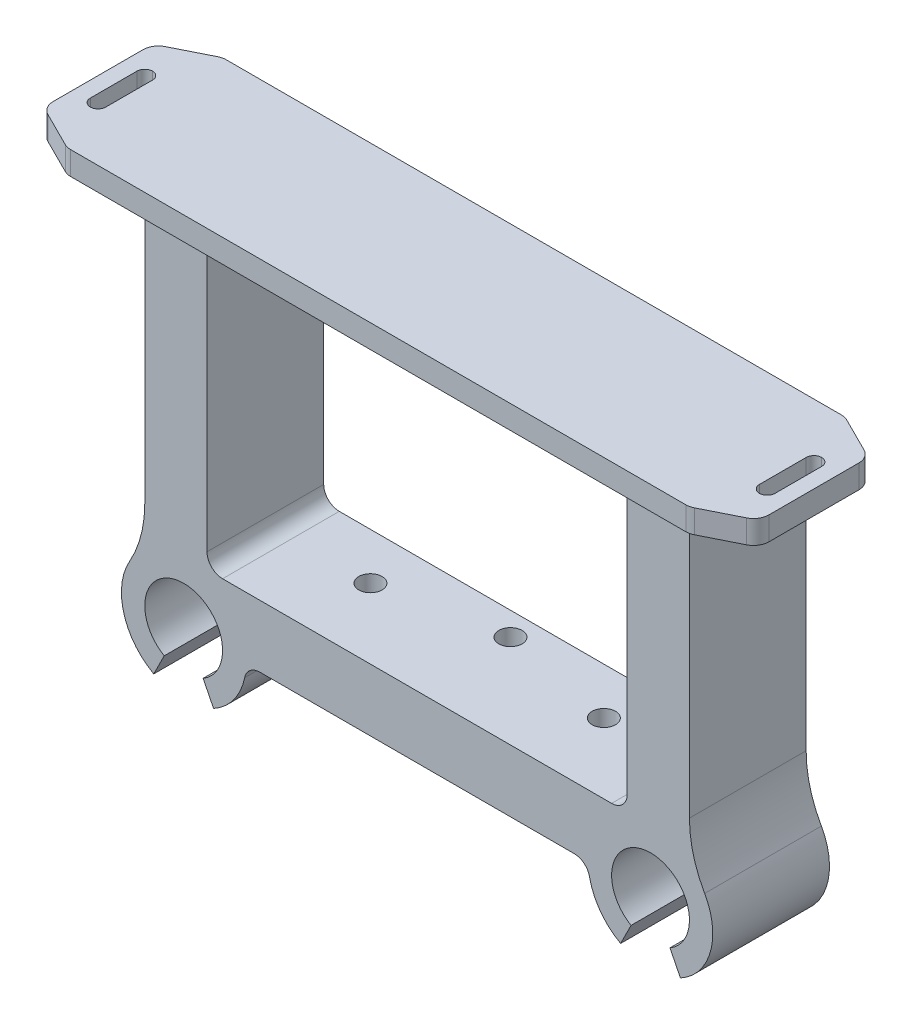
from build123d import *

# Parameters (mm, degrees)
BOSS_EXTRUDE1_DEPTH = 15
SKETCH4_R           = 8.000000000000002
SKETCH4_R_2         = 7.999999999999998
BOSS_EXTRUDE2_DEPTH = 15
SKETCH5_R           = 5.000000000000004
SKETCH5_R_2         = 5.0000000000000036
CUT_EXTRUDE2_DEPTH  = 15
FILLET2_R           = 15
FILLET3_R           = 2
FILLET4_R           = 2
BOSS_EXTRUDE3_DEPTH = 3
CUT_EXTRUDE3_REACH  = 76.188
SKETCH10_R          = 1.5000000000000007
SKETCH10_R_2        = 1.500000000000004
BOSS_EXTRUDE4_DEPTH = 10.000000000000002
BOSS_EXTRUDE5_DEPTH = 3
CUT_EXTRUDE5_REACH  = 90.637
FILLET5_R           = 1
FILLET6_R           = 2
CUT_EXTRUDE6_REACH  = 80.013
FILLET7_R           = 6
FILLET8_R           = 6
FILLET9_R           = 2
CUT_EXTRUDE7_DEPTH  = 15
FILLET10_R          = 2


# Some blends are built 0.0001 mm under size
with BuildPart() as part:
    # Sketch1 → Boss-Extrude1 (new body)
    with BuildSketch(Plane.XY):
        Polygon((-17.948335406616224, 38.357764788911155), (-17.948335406616224, -1.642235211088847), (-9.948335406616222, -1.6422352110888458), (-9.948335406616222, 38.35776478891115), align=None)
        Polygon((52.051664593383784, -1.6422352110888379), (52.051664593383784, -9.642235211088838), (-17.948335406616224, -9.642235211088838), (-17.948335406616224, -1.642235211088847), align=None)
        Polygon((44.051664593383784, 38.35776478891116), (44.051664593383784, -1.6422352110888392), (52.05166459338378, -1.6422352110888379), (52.051664593383784, 38.35776478891116), align=None)
    extrude(amount=BOSS_EXTRUDE1_DEPTH)

    # Sketch4 → Boss-Extrude2 (add)
    with BuildSketch(Plane.XY.offset(15)):
        with Locations((-12.948335406616222, -9.642235211088838)):
            Circle(SKETCH4_R)
        with Locations((47.05166459338378, -9.64223521108884)):
            Circle(SKETCH4_R_2)
    extrude(amount=-BOSS_EXTRUDE2_DEPTH)

    # Sketch5 → Cut-Extrude2 (cut)
    with BuildSketch(Plane.XY.offset(15)):
        with Locations((-12.948335406616222, -9.642235211088838)):
            Circle(SKETCH5_R)
        with Locations((47.05166459338378, -9.642235211088837)):
            Circle(SKETCH5_R_2)
    extrude(amount=-CUT_EXTRUDE2_DEPTH, mode=Mode.SUBTRACT)

    # Fillet2
    fillet2_edges = [part.edges().sort_by_distance(p)[0] for p in [
        (-17.948335406616224, -3.397237212690439, 7.5),
        (52.051664593383784, -3.3972372126904498, 7.5),
    ]]
    fillet(fillet2_edges, radius=FILLET2_R)

    # Fillet3
    fillet3_edges = [part.edges().sort_by_distance(p)[0] for p in [
        (-4.94833540661622, -9.642235211088838, 7.5),
        (39.05166459338378, -9.642235211088838, 7.5),
    ]]
    fillet(fillet3_edges, radius=FILLET3_R)

    # Fillet4
    fillet4_edges = [part.edges().sort_by_distance(p)[0] for p in [
        (-9.948335406616222, -1.6422352110888463, 7.5),
        (44.051664593383784, -1.6422352110888392, 7.5),
    ]]
    fillet(fillet4_edges, radius=FILLET4_R)

    # Sketch6 → Boss-Extrude3 (add)
    with BuildSketch(Plane(origin=(3.327e-14, 38.35776478891114, 0), x_dir=(1, -4.3e-16, 0), z_dir=(4.3e-16, 1, 0))):
        Polygon((-22.948335406616234, 0), (57.05166459338378, 0), (57.05166459338378, -20), (-22.948335406616227, -20), align=None)
    extrude(amount=BOSS_EXTRUDE3_DEPTH)

    # Sketch10 → Cut-Extrude3 (cut, up to next)
    with BuildSketch(Plane(origin=(2.1e-16, -1.6422352110888447, 0), x_dir=(1, 1.3e-16, 0), z_dir=(-1.3e-16, 1, 0)), mode=Mode.PRIVATE) as cut_extrude3_sk1:
        with Locations(Location((2.0516645933837814, -6, 0), (0, 0, 180))):
            Circle(SKETCH10_R)
    cut_extrude3_tool1 = extrude(cut_extrude3_sk1.sketch, amount=-CUT_EXTRUDE3_REACH, mode=Mode.PRIVATE) & part.part
    # Sketch10 → Cut-Extrude3 (cut, up to next)
    with BuildSketch(Plane(origin=(2.1e-16, -1.6422352110888447, 0), x_dir=(1, 1.3e-16, 0), z_dir=(-1.3e-16, 1, 0)), mode=Mode.PRIVATE) as cut_extrude3_sk2:
        with Locations(Location((17.05166459338378, -3, 0), (0, 0, 180))):
            Circle(SKETCH10_R)
    cut_extrude3_tool2 = extrude(cut_extrude3_sk2.sketch, amount=-CUT_EXTRUDE3_REACH, mode=Mode.PRIVATE) & part.part
    # Sketch10 → Cut-Extrude3 (cut, up to next)
    with BuildSketch(Plane(origin=(2.1e-16, -1.6422352110888447, 0), x_dir=(1, 1.3e-16, 0), z_dir=(-1.3e-16, 1, 0)), mode=Mode.PRIVATE) as cut_extrude3_sk3:
        with Locations(Location((32.051664593383784, -6, 0), (0, 0, 180))):
            Circle(SKETCH10_R_2)
    cut_extrude3_tool3 = extrude(cut_extrude3_sk3.sketch, amount=-CUT_EXTRUDE3_REACH, mode=Mode.PRIVATE) & part.part
    add(cut_extrude3_tool1.solids().sort_by_distance((2.051665, -1.642235, 6))[0], mode=Mode.SUBTRACT)
    add(cut_extrude3_tool2.solids().sort_by_distance((17.051665, -1.642235, 3))[0], mode=Mode.SUBTRACT)
    add(cut_extrude3_tool3.solids().sort_by_distance((32.051665, -1.642235, 6))[0], mode=Mode.SUBTRACT)

    # Sketch11 → Boss-Extrude4 (add)
    with BuildSketch(Plane.XZ.offset(-38.35776478891114)):
        Polygon((24.55166459338377, 7.3e-16), (9.551664593383764, -2.02e-15), (9.551664593383764, 8.311370234309834), (24.551664593383766, 8.311370234309837), align=None)
    extrude(amount=BOSS_EXTRUDE4_DEPTH)

    # Sketch12 → Boss-Extrude5 (add)
    with BuildSketch(Plane(origin=(1.794e-14, 41.35776478891114, 0), x_dir=(1, -4.3e-16, 0), z_dir=(4.3e-16, 1, 0))):
        Polygon((-22.948335406616234, 0), (-28.94833540661623, -3), (-28.94833540661623, -17), (-22.948335406616227, -20), align=None)
        Polygon((57.05166459338377, -20.000000000000057), (63.05166459338377, -16.999999999999943), (63.05166459338377, -2.9999999999999574), (57.05166459338377, 0), align=None)
    extrude(amount=-BOSS_EXTRUDE5_DEPTH)

    # Sketch13 → Cut-Extrude5 (cut, up to next)
    with BuildSketch(Plane(origin=(1.794e-14, 41.35776478891114, 0), x_dir=(1, -4.3e-16, 0), z_dir=(4.3e-16, 1, 0)), mode=Mode.PRIVATE) as cut_extrude5_sk1:
        Polygon((59.05166459338377, -6), (61.05166459338377, -6), (61.05166459338378, -14), (59.05166459338377, -14), align=None)
    cut_extrude5_tool1 = extrude(cut_extrude5_sk1.sketch, amount=-CUT_EXTRUDE5_REACH, mode=Mode.PRIVATE) & part.part
    # Sketch13 → Cut-Extrude5 (cut, up to next)
    with BuildSketch(Plane(origin=(1.794e-14, 41.35776478891114, 0), x_dir=(1, -4.3e-16, 0), z_dir=(4.3e-16, 1, 0)), mode=Mode.PRIVATE) as cut_extrude5_sk2:
        Polygon((-26.948335406616234, -5.999999999999999), (-24.94833540661623, -6), (-24.94833540661623, -14.000000000000002), (-26.948335406616234, -14.000000000000002), align=None)
    cut_extrude5_tool2 = extrude(cut_extrude5_sk2.sketch, amount=-CUT_EXTRUDE5_REACH, mode=Mode.PRIVATE) & part.part
    add(cut_extrude5_tool1.solids().sort_by_distance((60.051665, 41.357765, 10))[0], mode=Mode.SUBTRACT)
    add(cut_extrude5_tool2.solids().sort_by_distance((-25.948335, 41.357765, 10))[0], mode=Mode.SUBTRACT)

    # Fillet5
    fillet5_edges = [part.edges().sort_by_distance(p)[0] for p in [
        (59.05166459338379, 39.85776478891111, 6),
        (61.05166459338379, 39.85776478891111, 6),
        (61.0516645933838, 39.85776478891111, 14),
        (59.05166459338379, 39.85776478891111, 14),
        (-26.948335406616216, 39.857764788911155, 14.000000000000002),
        (-24.948335406616213, 39.857764788911155, 14.000000000000002),
        (-24.948335406616213, 39.857764788911155, 6),
        (-26.948335406616216, 39.857764788911155, 5.999999999999999),
    ]]
    fillet(fillet5_edges, radius=FILLET5_R - 0.0001)  # a hair under: the kernel refuses the full size

    # Fillet6
    fillet6_edges = [part.edges().sort_by_distance(p)[0] for p in [
        (-22.948335406616202, 39.85776478891115, 0),
        (-22.948335406616195, 39.85776478891115, 20),
        (57.05166459338381, 39.85776478891112, 20),
        (57.05166459338381, 39.85776478891112, 0),
        (-28.948335406616213, 39.857764788911155, 17),
        (-28.948335406616213, 39.857764788911155, 3),
        (63.05166459338379, 39.85776478891111, 2.9999999999999574),
        (63.05166459338379, 39.85776478891111, 16.999999999999943),
    ]]
    fillet(fillet6_edges, radius=FILLET6_R)

    # Sketch14 → Cut-Extrude6 (cut, up to next)
    with BuildSketch(Plane(origin=(0, 0, 0), x_dir=(-1, 0, 0), z_dir=(0, 0, -1)), mode=Mode.PRIVATE) as cut_extrude6_sk1:
        Polygon((-42.051664593383784, -18.97236223001103), (-52.05166459338378, -18.97236223001103), (-49.55166459338378, -13.972362230011036), (-44.55166459338378, -13.972362230011036), align=None)
    cut_extrude6_tool1 = extrude(cut_extrude6_sk1.sketch, amount=-CUT_EXTRUDE6_REACH, mode=Mode.PRIVATE) & part.part
    # Sketch14 → Cut-Extrude6 (cut, up to next)
    with BuildSketch(Plane(origin=(0, 0, 0), x_dir=(-1, 0, 0), z_dir=(0, 0, -1)), mode=Mode.PRIVATE) as cut_extrude6_sk2:
        Polygon((17.948335406616224, -18.972362230011036), (7.948335406616221, -18.972362230011036), (10.448335406616224, -13.972362230011036), (15.448335406616224, -13.972362230011036), align=None)
    cut_extrude6_tool2 = extrude(cut_extrude6_sk2.sketch, amount=-CUT_EXTRUDE6_REACH, mode=Mode.PRIVATE) & part.part
    add(cut_extrude6_tool1.solids().sort_by_distance((47.051665, -16.75014, 0))[0], mode=Mode.SUBTRACT)
    add(cut_extrude6_tool2.solids().sort_by_distance((-12.948335, -16.75014, 0))[0], mode=Mode.SUBTRACT)

    # Fillet7
    fillet7_edges = [part.edges().sort_by_distance(p)[0] for p in [
        (24.55166459338378, 28.35776478891113, 4.155685117154919),
        (9.551664593383776, 28.357764788911137, 4.155685117154916),
    ]]
    fillet(fillet7_edges, radius=FILLET7_R)

    # Fillet8
    # the kernel refuses this fillet: 6 mm, written as the material it adds along each edge
    with BuildSketch(Plane(origin=(24.551664593383784, 38.35776478891113, 8.311370234309837), x_dir=(1, -1.22e-15, 4.3e-16), z_dir=(4.3e-16, 0, -1))) as fillet8_piece_1:
        with BuildLine():
            CenterArc((5.832159566204599, 6), FILLET8_R, 189.5940682268561, 80.40593177314383)
            Line((-0.08392021689509223, 5.000000000000448), (-0.675528195205062, 4.90000000000049))
            ThreePointArc((-0.675528195205062, 4.90000000000049), (-0.5999999999999965, 4.000000000000001), (-0.6000000000000014, 7.3e-16))
            Line((-0.6000000000000014, 7.3e-16), (-7.3e-16, -0.6000000000000014))
            Line((-7.3e-16, -0.6000000000000014), (5.832159566204594, -0.6000000000000014))
            Line((5.832159566204594, -0.6000000000000014), (5.832159566204595, 0))
        make_face()
    extrude(amount=8.311370234309837)
    with BuildSketch(Plane(origin=(9.55166459338378, 38.35776478891113, -2.02e-15), x_dir=(0.01678167981240219, -0.9998591776958763, 0), z_dir=(0, 0, 1))) as fillet8_piece_2:
        with BuildLine():
            CenterArc((5.901281631719588, -5.932028346925651), FILLET8_R, 98.63250366346277, 80.40593177319276)
            Line((-0.09787343445575636, -5.831338268056363), (-0.6977889410732921, -5.8212692601694345))
            Line((-0.6977889410732921, -5.8212692601694345), (-0.5999155066175272, 0.01006900788744134))
            Line((-0.5999155066175272, 0.01006900788744134), (0.01006900788744131, 0.5999155066175255))
            ThreePointArc((0.01006900788744131, 0.5999155066175255), (4.009505718670954, 0.5327887873679148), (4.9106464685856706, 0.5932028346925657))
            Line((4.9106464685856706, 0.5932028346925657), (5.000704210688756, 1e-17))
        make_face()
    extrude(amount=8.311370234309836)

    # Fillet9
    fillet9_edges = [part.edges().sort_by_distance(p)[0] for p in [
        (17.05166459338424, 38.35776478891257, 8.31137023431),
    ]]
    fillet(fillet9_edges, radius=FILLET9_R)

    # Sketch15 → Cut-Extrude7 (cut)
    with BuildSketch(Plane(origin=(0, 0, 0), x_dir=(-1, 0, 0), z_dir=(0, 0, -1))):
        Polygon((-12.43286243986677, 34.35776478891113), (-14.742263516625279, 38.35776478891114), (-19.36106567014228, 38.35776478891114), (-21.67046674690079, 34.35776478891113), (-19.36106567014228, 30.357764788911126), (-14.742263516625275, 30.357764788911126), align=None)
    extrude(amount=-CUT_EXTRUDE7_DEPTH, mode=Mode.SUBTRACT)

    # Fillet10
    fillet10_edges = [part.edges().sort_by_distance(p)[0] for p in [
        (-17.948335406616224, 38.357764788911155, 7.5),
        (-9.948335406616222, 38.35776478891115, 7.5),
        (44.051664593383784, 38.35776478891116, 7.5),
        (52.051664593383784, 38.35776478891116, 7.5),
        (48.051664593383784, 38.35776478891116, 15),
        (-13.948335406616224, 38.357764788911155, 15),
    ]]
    fillet(fillet10_edges, radius=FILLET10_R)


solid = part.part
